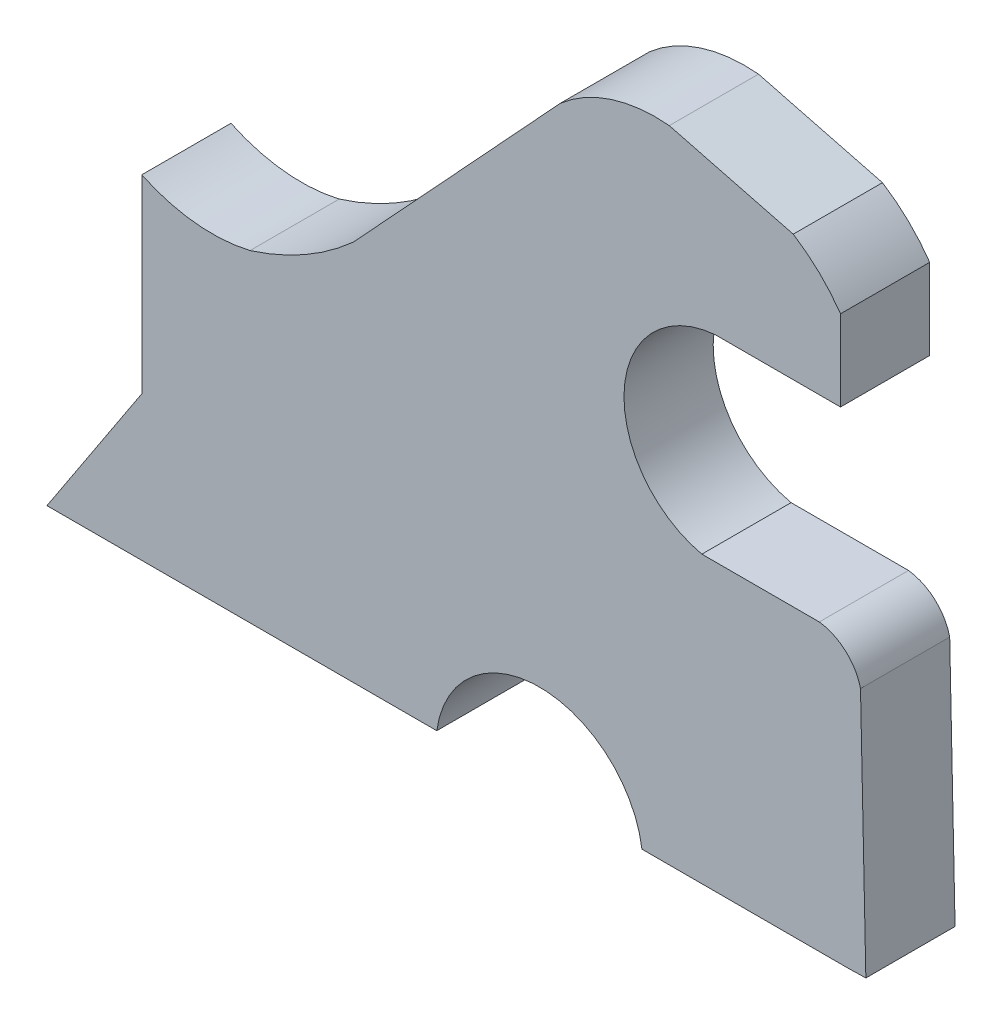
from build123d import *

# Parameters (mm, degrees)
TABAN_FLAN_1_DEPTH = 50


# Sheet-metal steps are written as plain solids
with BuildPart() as part:
    # Çizim1 → Taban-Flanş1 (new body)
    with BuildSketch(Plane.XY):
        with BuildLine():
            Line((0, 0), (218.5, 0))
            ThreePointArc((218.5, 0), (276, 50), (333.5, 0))
            Line((333.5, 0), (360, 0))
            Line((360, 0), (449, 0))
            Line((449, 0), (458.997671741, 0.215777088))
            Line((458.997671741, 0.215777088), (455.997671741, 139.215777088))
            ThreePointArc((455.997671741, 139.215777088), (447.698955646, 153.213358252), (432.909011054, 160))
            Line((432.909011054, 160), (367.081412811, 160))
            ThreePointArc((367.081412811, 160), (323.554697394, 218.317011668), (374.513743955, 270.265297284))
            Line((374.513743955, 270.265297284), (434.798113421, 270.265297284))
            Line((434.798113421, 270.265297284), (444.798113421, 270.265297284))
            Line((444.798113421, 270.265297284), (444.798113421, 315.516988045))
            ThreePointArc((444.798113421, 315.516988045), (432.826102146, 329.550683033), (418.309236409, 340.931994828))
            Line((418.309236409, 340.931994828), (348.808103312, 358.867771111))
            ThreePointArc((348.808103312, 358.867771111), (316.270646866, 355.31487857), (287.772711056, 339.215910531))
            Line((287.772711056, 339.215910531), (171.828858079, 213.879290682))
            ThreePointArc((171.828858079, 213.879290682), (144.61514494, 194.164293468), (113.814091907, 180.726941422))
            ThreePointArc((113.814091907, 180.726941422), (82.931673061, 178.777598724), (53.149679292, 187.177395023))
            Line((53.149679292, 187.177395023), (53.149679292, 80.862415296))
            Line((53.149679292, 80.862415296), (0, 0))
        make_face()
    extrude(amount=TABAN_FLAN_1_DEPTH)


solid = part.part
